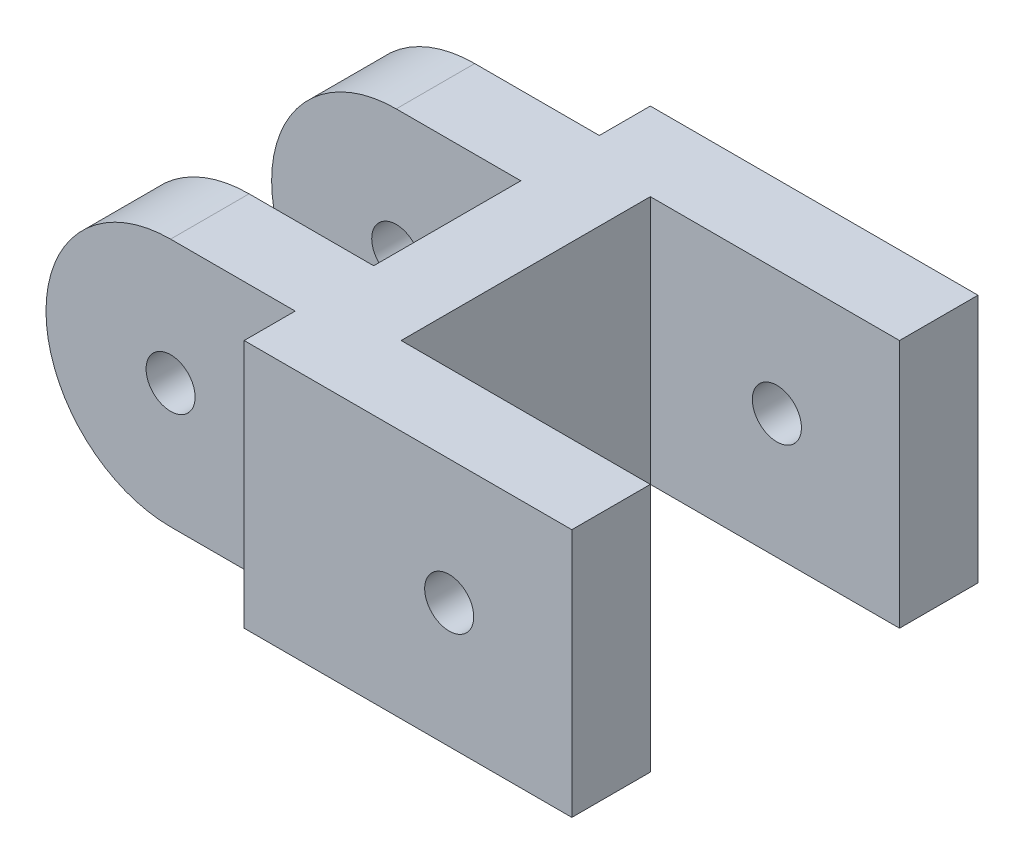
from build123d import *

# Parameters (mm, degrees)
BOSS_EXTRUDE1_DEPTH = 25.4
FILLET1_R           = 12.7
CUT_EXTRUDE1_REACH  = 67.579
SKETCH2_R           = 2.5
CUT_EXTRUDE2_REACH  = 70.586
SKETCH3_R           = 2.5


with BuildPart() as part:
    # Sketch1 → Boss-Extrude1 (new body)
    with BuildSketch(Plane(origin=(0, 0, 0), x_dir=(1, 0, 0), z_dir=(0, 1, 0))):
        Polygon((10.375, 15.95), (-15.025, 15.95), (-15.025, -9.45), (10.375, -9.45), (10.375, -17.45), (-23.025, -17.45), (-23.025, -12.25), (-48.425, -12.25), (-48.425, -4.25), (-23.025, -4.25), (-23.025, 10.75), (-48.425, 10.75), (-48.425, 18.75), (-23.025, 18.75), (-23.025, 23.95), (10.375, 23.95), align=None)
    extrude(amount=BOSS_EXTRUDE1_DEPTH)

    # Fillet1
    fillet1_edges = [part.edges().sort_by_distance(p)[0] for p in [
        (-48.425, 25.4, -14.75),
        (-48.425, 0, -14.75),
        (-48.425, 0, 8.25),
        (-48.425, 25.4, 8.25),
    ]]
    fillet(fillet1_edges, radius=FILLET1_R - 0.0001)  # a hair under: the kernel refuses the full size

    # Cut-Extrude1: up to this face of the body (flat: up to its plane)
    cut_extrude1_end = Plane(part.part.faces().sort_by_distance((-34.539475021, 12.7, -18.75))[0])
    # Sketch2 → Cut-Extrude1 (cut, up to the picked face)
    with BuildSketch(Plane.XY.offset(12.25), mode=Mode.PRIVATE) as cut_extrude1_sk1:
        with Locations((-35.725, 12.7)):
            Circle(SKETCH2_R)
    cut_extrude1_tool1 = split(extrude(cut_extrude1_sk1.sketch, amount=-CUT_EXTRUDE1_REACH, mode=Mode.PRIVATE), bisect_by=cut_extrude1_end, keep=Keep.BOTH, mode=Mode.PRIVATE)
    add(cut_extrude1_tool1.solids().sort_by(Axis((-35.725, 12.7, 12.25), (0, 0, -1)))[0], mode=Mode.SUBTRACT)

    # Cut-Extrude2: up to this face of the body (flat: up to its plane)
    cut_extrude2_end = Plane(part.part.faces().sort_by_distance((-6.325, 12.7, -23.95))[0])
    # Sketch3 → Cut-Extrude2 (cut, up to the picked face)
    with BuildSketch(Plane.XY.offset(17.45), mode=Mode.PRIVATE) as cut_extrude2_sk1:
        with Locations((-2.125, 12.7)):
            Circle(SKETCH3_R)
    cut_extrude2_tool1 = split(extrude(cut_extrude2_sk1.sketch, amount=-CUT_EXTRUDE2_REACH, mode=Mode.PRIVATE), bisect_by=cut_extrude2_end, keep=Keep.BOTH, mode=Mode.PRIVATE)
    add(cut_extrude2_tool1.solids().sort_by(Axis((-2.125, 12.7, 17.45), (0, 0, -1)))[0], mode=Mode.SUBTRACT)


solid = part.part
